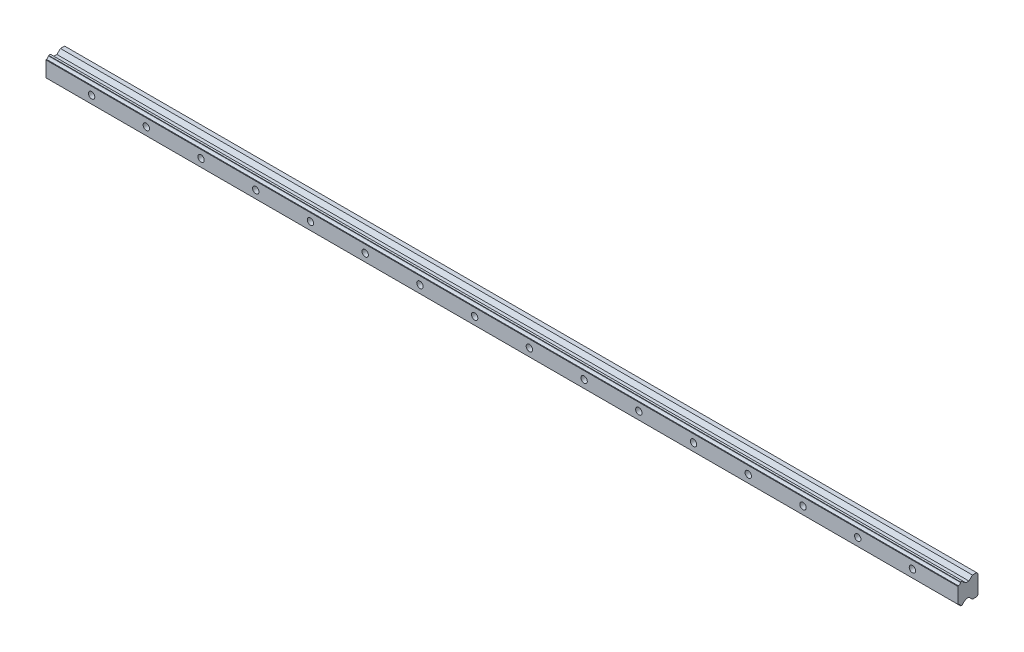
from build123d import *

# Parameters (mm, degrees)
RESSALTO_EXTRUS_O1_DEPTH = 1000
ESBO_O2_R                = 3.5
CORTE_EXTRUS_O1_DEPTH    = 981.312123765


# Read off the part's stored shape, not the designer's step: KR25-N.step
with BuildPart() as part:
    # Esboço1 → Ressalto-extrusão1 (new body)
    with BuildSketch(Plane.ZY.offset(20)):
        with BuildLine():
            Line((0, 10), (0, -10))
            Line((0, -10), (1.5, -11.5))
            Line((1.5, -11.5), (6.0986495, -11.5))
            Line((6.0986495, -11.5), (9.898648987, -7.7))
            Line((9.898648987, -7.7), (13.280138132, -7.7))
            Line((13.280138132, -7.7), (14.509842724, -8.929704991))
            ThreePointArc((14.509842724, -8.929704991), (16.046259432, -9.658087148), (16.774641091, -11.194504091))
            Line((16.774641091, -11.194504091), (16.980137, -11.4))
            Line((16.980137, -11.4), (19.008698, -11.4))
            Line((19.008698, -11.4), (19.226365837, -11.182332163))
            ThreePointArc((19.226365837, -11.182332163), (19.953497116, -9.6580866), (21.477742889, -8.93095576))
            Line((21.477742889, -8.93095576), (21.9, -8.508698852))
            Line((21.9, -8.508698852), (21.9, 8.508698852))
            Line((21.9, 8.508698852), (21.477742889, 8.93095576))
            ThreePointArc((21.477742889, 8.93095576), (19.953497116, 9.6580866), (19.226365837, 11.182332163))
            Line((19.226365837, 11.182332163), (19.008698, 11.4))
            Line((19.008698, 11.4), (16.980137, 11.4))
            Line((16.980137, 11.4), (16.774641091, 11.194504091))
            ThreePointArc((16.774641091, 11.194504091), (16.046259432, 9.658087148), (14.509842724, 8.929704991))
            Line((14.509842724, 8.929704991), (13.280138132, 7.7))
            Line((13.280138132, 7.7), (9.898648987, 7.7))
            Line((9.898648987, 7.7), (6.0986495, 11.5))
            Line((6.0986495, 11.5), (1.5, 11.5))
            Line((1.5, 11.5), (0, 10))
        make_face()
    extrude(amount=-RESSALTO_EXTRUS_O1_DEPTH)

    # Esboço2 → Corte-extrusão1 (cut, through all)
    with BuildSketch(Plane.XY.offset(21.9)):
        with Locations((30, 0)):
            Circle(ESBO_O2_R)
        with Locations((90, 0)):
            Circle(ESBO_O2_R)
        with Locations((150, 0)):
            Circle(ESBO_O2_R)
        with Locations((210, 0)):
            Circle(ESBO_O2_R)
        with Locations((270, 0)):
            Circle(ESBO_O2_R)
        with Locations((330, 0)):
            Circle(ESBO_O2_R)
        with Locations((390, 0)):
            Circle(ESBO_O2_R)
        with Locations((450, 0)):
            Circle(ESBO_O2_R)
        with Locations((510, 0)):
            Circle(ESBO_O2_R)
        with Locations((570, 0)):
            Circle(ESBO_O2_R)
        with Locations((630, 0)):
            Circle(ESBO_O2_R)
        with Locations((690, 0)):
            Circle(ESBO_O2_R)
        with Locations((750, 0)):
            Circle(ESBO_O2_R)
        with Locations((810, 0)):
            Circle(ESBO_O2_R)
        with Locations((870, 0)):
            Circle(ESBO_O2_R)
        with Locations((930, 0)):
            Circle(ESBO_O2_R)
    extrude(amount=-CORTE_EXTRUS_O1_DEPTH, mode=Mode.SUBTRACT)


solid = part.part
